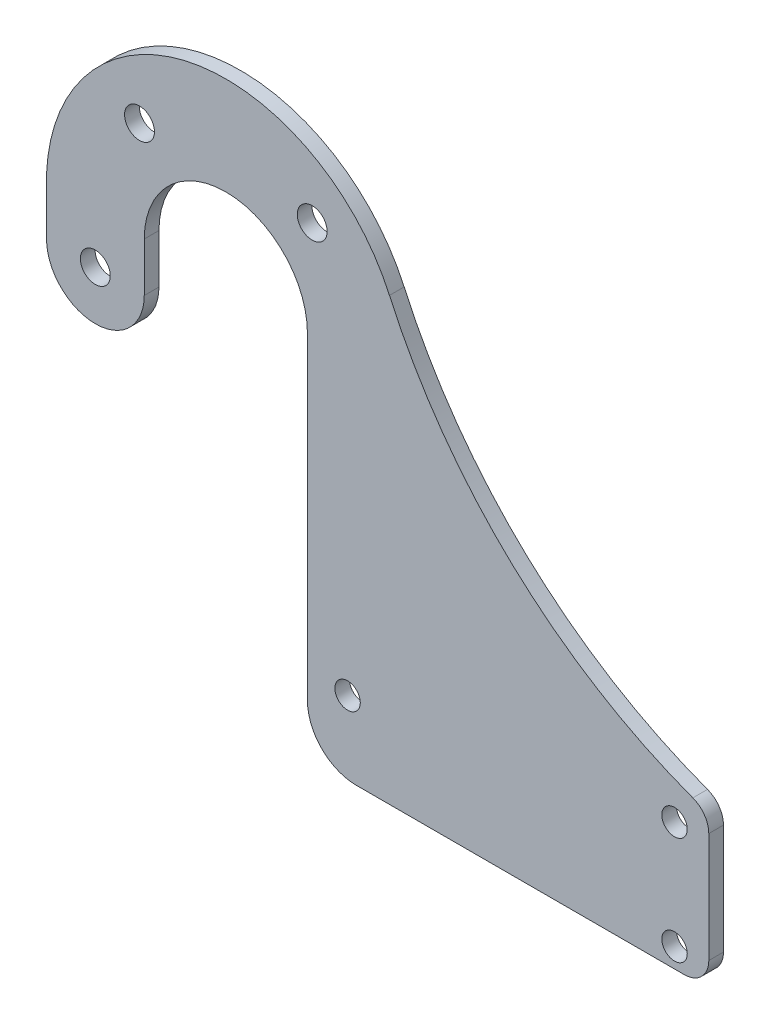
from build123d import *

# Parameters (mm, degrees)
ESBO_O1_R                = 2.6
RESSALTO_EXTRUS_O1_DEPTH = 3
FILETE2_R                = 110
FILETE3_R                = 4
RESSALTO_EXTRUS_O2_DEPTH = 3
FILETE4_R                = 10
FILETE5_R                = 10
FILETE6_R                = 5
ESBO_O3_R                = 3.05
CORTE_EXTRUS_O1_DEPTH    = 10


with BuildPart() as part:
    # Esboço1 → Ressalto-extrusão1 (new body)
    with BuildSketch(Plane.XY):
        with BuildLine():
            Line((-82, 75), (-82, 0))
            Line((-82, 0), (0, 0))
            Line((0, 0), (0, 31))
            Line((0, 31), (-62, 31))
            Line((-62, 31), (-62, 75))
            ThreePointArc((-62, 75), (-99.43321729, 111.660780356), (-135.305624889, 73.47139772))
            Line((-135.305624889, 73.47139772), (-135.305624889, 63.47139772))
            Line((-135.305624889, 63.47139772), (-115.3375, 75))
            ThreePointArc((-115.3375, 75), (-98.66875, 91.66875), (-82, 75))
        make_face()
        with Locations((-7, 26)):
            Circle(ESBO_O1_R, mode=Mode.SUBTRACT)
        with Locations((-73.8, 15)):
            Circle(ESBO_O1_R, mode=Mode.SUBTRACT)
        with Locations((-7, 4)):
            Circle(ESBO_O1_R, mode=Mode.SUBTRACT)
    extrude(amount=RESSALTO_EXTRUS_O1_DEPTH)

    # Filete2
    # the kernel refuses this fillet: 110 mm, written as the material it adds along each edge
    with BuildSketch(Plane(origin=(-62, 31, 0), x_dir=(1, 0, 0), z_dir=(0, 0, 1))) as filete2_piece_1_section:
        with BuildLine():
            CenterArc((97.045462199, 104.267998826), FILETE2_R, 204.262159278, 47.159856314)
            Line((-3.238772458, 59.067641757), (-13.267195924, 54.54760605))
            ThreePointArc((-13.267195924, 54.54760605), (-11, 44), (-11, 0))
            Line((-11, 0), (0, -11))
            ThreePointArc((0, -11), (31, -11), (58.49545378, -10.426799883))
            Line((58.49545378, -10.426799883), (62, 0))
        make_face()
    filete2_piece_1 = extrude(amount=3, mode=Mode.PRIVATE)
    filete2_piece_1 = filete2_piece_1 - Plane(origin=(-7, 26, 1.5), x_dir=(1, 0, 0), z_dir=(0, 0, -1)) * Cylinder(2.6, 255, mode=Mode.PRIVATE)
    add(filete2_piece_1)

    # Filete3
    filete3_edges = [part.edges().sort_by_distance(p)[0] for p in [
        (-135.305624889, 63.47139772, 1.5),
    ]]
    fillet(filete3_edges, radius=FILETE3_R)

    # Esboço2 → Ressalto-extrusão2 (add, through all)
    with BuildSketch(Plane.XY.offset(3)):
        with BuildLine():
            ThreePointArc((-129.305624889, 66.935499335), (-133.305624889, 66.935499335), (-135.305624889, 70.39960095))
            Line((-135.305624889, 70.39960095), (-135.305624889, 55))
            Line((-135.305624889, 55), (-115.3375, 55))
            Line((-115.3375, 55), (-115.3375, 75))
            Line((-115.3375, 75), (-129.305624889, 66.935499335))
        make_face()
    extrude(amount=-RESSALTO_EXTRUS_O2_DEPTH)

    # Filete4
    # the kernel refuses this fillet: 10 mm, written as the material it takes off along each edge
    with BuildSketch(Plane(origin=(-135.305624889, 55, 28), x_dir=(0, 1, 0), z_dir=(0, 0, -1)), Plane(origin=(-115.3375, 55, 28), x_dir=(-1, 0, 0), z_dir=(0, 0, -1))) as filete4_piece_1:
        with BuildLine():
            CenterArc((FILETE4_R, FILETE4_R), FILETE4_R, 180, 90)
            Line((0, FILETE4_R), (0, 0))
            Line((0, 0), (FILETE4_R, 0))
        make_face()
    extrude(amount=53, mode=Mode.SUBTRACT)

    # Filete5
    filete5_edges = [part.edges().sort_by_distance(p)[0] for p in [
        (-82, 0, 1.5),
    ]]
    fillet(filete5_edges, radius=FILETE5_R)

    # Filete6
    filete6_edges = [part.edges().sort_by_distance(p)[0] for p in [
        (0, 31, 1.5),
        (0, 0, 1.5),
    ]]
    fillet(filete6_edges, radius=FILETE6_R)

    # Esboço3 → Corte-extrusão1 (cut)
    with BuildSketch(Plane.XY.offset(3)):
        with Locations((-125.3375, 65)):
            Circle(ESBO_O3_R)
        with Locations((-116.31024162, 95)):
            Circle(ESBO_O3_R)
        with Locations((-81.02725838, 95)):
            Circle(ESBO_O3_R)
    extrude(amount=-CORTE_EXTRUS_O1_DEPTH, mode=Mode.SUBTRACT)


solid = part.part
